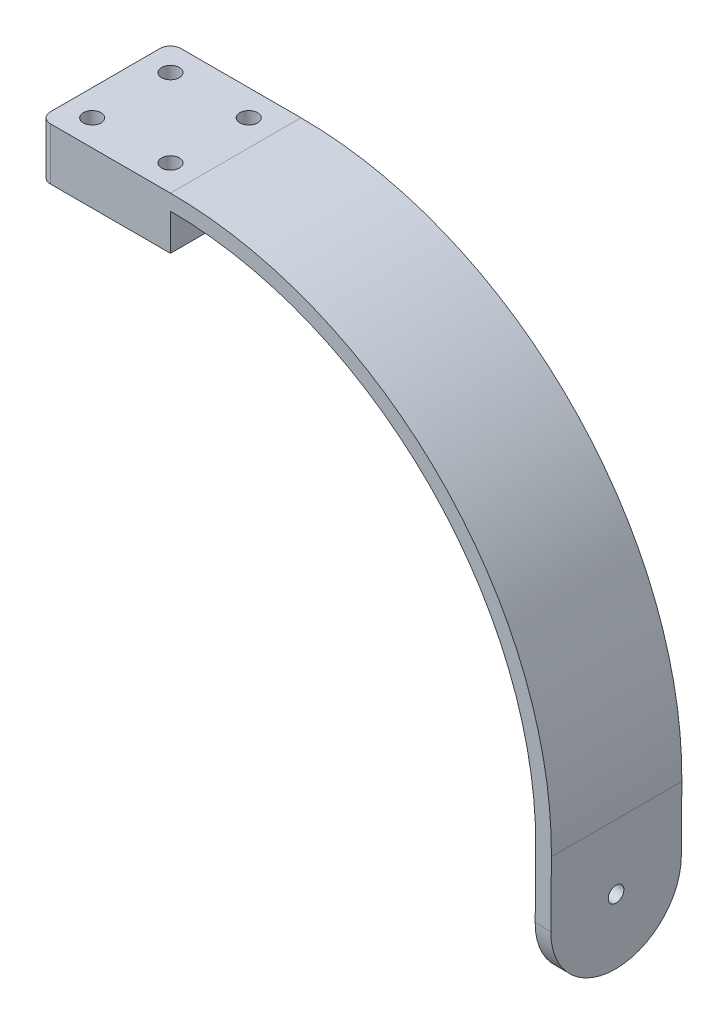
from build123d import *

# Parameters (mm, degrees)
BOSS_EXTRUDE1_DEPTH  = 25
CUT_EXTRUDE1_REACH   = 127.103
SKETCH6_R            = 1.5
FILLET1_R            = 12.5
SKETCH8_W            = 25
SKETCH8_H            = 25
BOSS_EXTRUDE2_DEPTH  = 7
FILLET2_R            = 2
M3_CLEARANCE_HOLE1_D = 3.4


with BuildPart() as part:
    # Sketch2 → Boss-Extrude1 (new body)
    with BuildSketch(Plane.XY):
        with BuildLine():
            Line((0, 73), (-25, 73))
            Line((-25, 73), (-25, 70))
            Line((-25, 70), (0, 70))
            ThreePointArc((0, 70), (49.712976294, 49.281030712), (69.997334614, -0.610857485))
            Line((69.997334614, -0.610857485), (69.779171227, -25.609905561))
            Line((69.779171227, -25.609905561), (72.779056996, -25.636085168))
            Line((72.779056996, -25.636085168), (72.997220384, -0.637037091))
            ThreePointArc((72.997220384, -0.637037091), (51.84353242, 51.393074885), (0, 73))
        make_face()
    extrude(amount=BOSS_EXTRUDE1_DEPTH)

    # Sketch6 → Cut-Extrude1 (cut, up to next)
    with BuildSketch(Plane(origin=(72.997220384, -0.637037091, 0), x_dir=(0, 0, -1), z_dir=(0.9999619230641714, -0.00872653549837746, 0)), mode=Mode.PRIVATE) as cut_extrude1_sk1:
        with Locations(Location((-12.5, -12.5, 0), (0, 0, 90))):
            Circle(SKETCH6_R)
    cut_extrude1_tool1 = extrude(cut_extrude1_sk1.sketch, amount=-CUT_EXTRUDE1_REACH, mode=Mode.PRIVATE) & part.part
    add(cut_extrude1_tool1.solids().sort_by_distance((72.888139, -13.136561, 12.5))[0], mode=Mode.SUBTRACT)

    # Fillet1
    fillet1_edges = [part.edges().sort_by_distance(p)[0] for p in [
        (71.279114112, -25.622995365, 0),
        (71.279114112, -25.622995365, 25),
    ]]
    fillet(fillet1_edges, radius=FILLET1_R - 0.0001)  # a hair under: the kernel refuses the full size

    # Sketch8 → Boss-Extrude2 (add)
    with BuildSketch(Plane.XZ.offset(-70)):
        with Locations((-12.5, 12.5)):
            Rectangle(SKETCH8_W, SKETCH8_H)
    extrude(amount=BOSS_EXTRUDE2_DEPTH)

    # Fillet2
    fillet2_edges = [part.edges().sort_by_distance(p)[0] for p in [
        (-25, 68, 25),
        (-25, 68, 0),
    ]]
    fillet(fillet2_edges, radius=FILLET2_R)

    # M3 Clearance Hole1 (through all)
    with Locations(Plane(origin=(0, 73, 0), x_dir=(1, 0, 0), z_dir=(0, 1, 0))):
        with Locations((-20, -5), (-5, -20), (-20, -20), (-5, -5)):
            Hole(M3_CLEARANCE_HOLE1_D / 2)


solid = part.part
